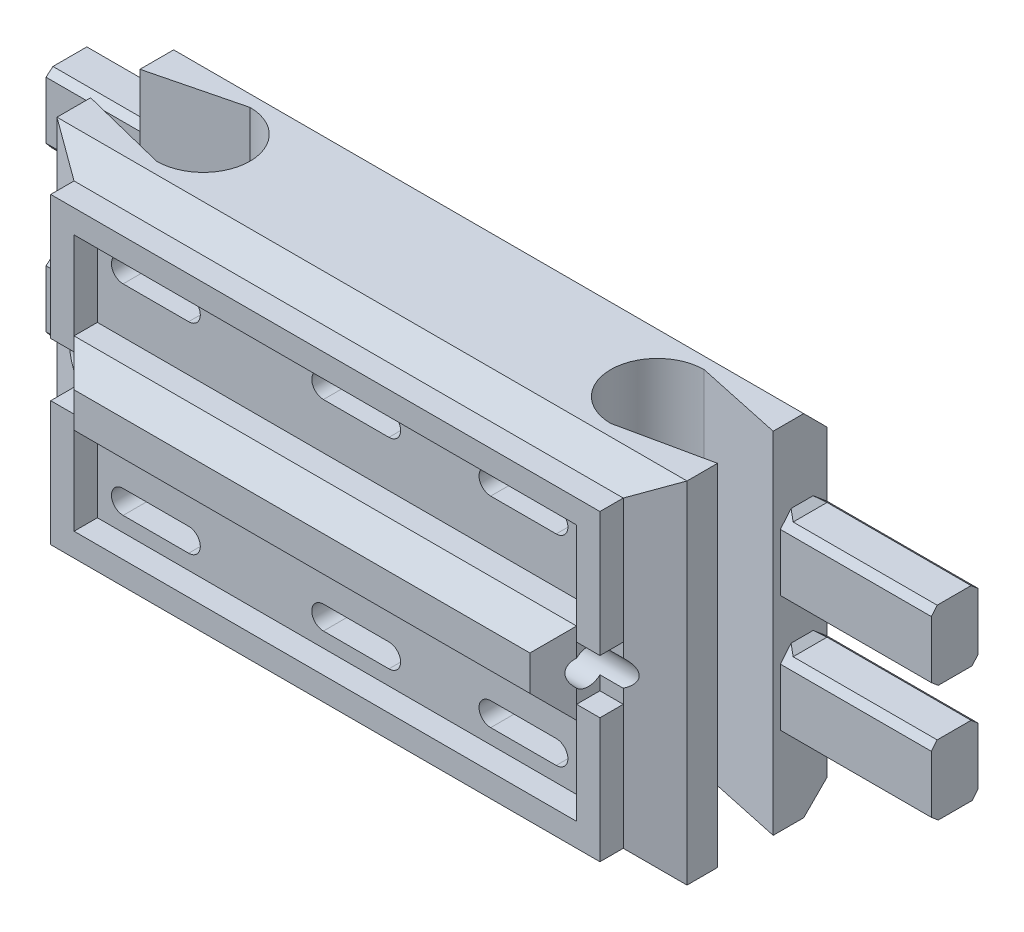
from build123d import *
from OCP.BRepFilletAPI import BRepFilletAPI_MakeChamfer

# Parameters (mm, degrees)
BASE_W                  = 27
BASE_H                  = 15
BOSS_EXTRUDE1_DEPTH     = 7
CHAMFER4_SIZE           = 1
CHAMFER5_SIZE           = 1
CHAMFER5_SIZE2          = 1.732050808
CHAMFER6_SIZE           = 1
SKETCH8_W               = 21.535898384
SKETCH8_H               = 3.5
BOSS_EXTRUDE5_DEPTH     = 2
CUT_EXTRUDE5_DEPTH      = 4.254422658
CUT_EXTRUDE5_DEPTH_BACK = 34.5
SKETCH9_R               = 0.75
CHAMFER9_SIZE           = 1
SKETCH13_W              = 7.5
SKETCH13_H              = 3.5
BOSS_EXTRUDE6_DEPTH     = 2
CHAMFER10_SIZE          = 1
CUT_EXTRUDE6_DEPTH      = 3
CUT_EXTRUDE6_DEPTH_BACK = 30
SKETCH14_R              = 0.75
SKETCH15_W              = 1
SKETCH15_H              = 3.5
BOSS_EXTRUDE7_DEPTH     = 2
CUT_EXTRUDE7_DEPTH      = 26
CHAMFER11_SIZE          = 0.3
CHAMFER12_SIZE          = 0.75
CUT_EXTRUDE8_DEPTH      = 15
SKETCH18_W              = 2
SKETCH18_H              = 3
BOSS_EXTRUDE8_DEPTH     = 6.47
CHAMFER13_SIZE          = 0.25
CHAMFER13_SIZE2         = 0.297938398
CHAMFER14_SIZE          = 0.25
CHAMFER14_SIZE2         = 0.297938398
SKETCH19_W              = 2
SKETCH19_H              = 3
BOSS_EXTRUDE9_DEPTH     = 4.47
CHAMFER15_SIZE          = 0.25
CHAMFER15_SIZE2         = 0.297938398
CHAMFER16_SIZE          = 0.25
CHAMFER16_SIZE2         = 0.297938398
BOSS_EXTRUDE10_DEPTH    = 1
CUT_EXTRUDE9_DEPTH      = 1


with BuildPart() as part:
    # Base → Boss-Extrude1 (new body)
    with BuildSketch(Plane.XY):
        with Locations((13.5, 7.5)):
            Rectangle(BASE_W, BASE_H)
    extrude(amount=BOSS_EXTRUDE1_DEPTH)

    # Chamfer4
    chamfer4_edges = [part.edges().sort_by_distance(p)[0] for p in [
        (13.5, 15, 7),
        (13.5, 0, 7),
    ]]
    chamfer(chamfer4_edges, length=CHAMFER4_SIZE)

    # Chamfer5: one chamfer whose edges measure the first distance from different faces: ONE call of the kernel's chamfer builder (chamfer() names one face for all edges)
    chamfer5_edges_1 = [part.edges().sort_by_distance(p)[0] for p in [
        (0, 7.5, 7),
    ]]
    chamfer5_side_1 = [part.faces().sort_by_distance(p)[0] for p in [
        (0, 7.5, 3.469551282),
    ]]
    chamfer5_edges_2 = [part.edges().sort_by_distance(p)[0] for p in [
        (27, 7.5, 7),
    ]]
    chamfer5_side_2 = [part.faces().sort_by_distance(p)[0] for p in [
        (27, 7.5, 3.469551282),
    ]]
    chamfer5 = BRepFilletAPI_MakeChamfer(part.part.solid().wrapped)
    for e in chamfer5_edges_1:
        chamfer5.Add(CHAMFER5_SIZE, CHAMFER5_SIZE2, e.wrapped, chamfer5_side_1[0].wrapped)  # the first distance lies on this face
    for e in chamfer5_edges_2:
        chamfer5.Add(CHAMFER5_SIZE, CHAMFER5_SIZE2, e.wrapped, chamfer5_side_2[0].wrapped)  # the first distance lies on this face
    add(Compound.cast(chamfer5.Shape()), mode=Mode.REPLACE)

    # Chamfer6
    chamfer6_edges = [part.edges().sort_by_distance(p)[0] for p in [
        (13.5, 15, 0),
        (13.5, 0, 0),
    ]]
    chamfer(chamfer6_edges, length=CHAMFER6_SIZE)

    # Sketch8 → Boss-Extrude5 (add)
    with BuildSketch(Plane.XY.offset(7)):
        with Locations((13.5, 7.5)):
            Rectangle(SKETCH8_W, SKETCH8_H)
    extrude(amount=BOSS_EXTRUDE5_DEPTH)

    # Sketch9 → Cut-Extrude5 (cut, two sides: drawn at the far end of the back side and taken through both)
    with BuildSketch(Plane(origin=(24.267949192, 0, 0), x_dir=(0, 0, -1), z_dir=(1, 0, 0)).offset(-CUT_EXTRUDE5_DEPTH_BACK)):
        with Locations(Location((-7.5, 7.5, 0), (0, 0, 311.810314896))):
            Circle(SKETCH9_R)
    extrude(amount=CUT_EXTRUDE5_DEPTH + CUT_EXTRUDE5_DEPTH_BACK, mode=Mode.SUBTRACT)

    # Chamfer9
    # the kernel refuses this chamfer: 1 mm, written as the material it takes off along each edge
    with BuildSketch(Plane(origin=(26.83963218, 5.75, 9), x_dir=(0, -0.027495876610586487, -0.9996219169112968), z_dir=(-1, 0, 0)), Plane(origin=(0.16036782, 9.25, 9), x_dir=(0, 0.027495876610585623, -0.9996219169112968), z_dir=(1, 0, 0))) as chamfer9_piece_1:
        Polygon((CHAMFER9_SIZE * 0.999621916911, -CHAMFER9_SIZE * 0.0274958766106), (-CHAMFER9_SIZE * 0.0274958766106, -CHAMFER9_SIZE * 0.999621916911), (0, 0), align=None)
    extrude(amount=26.679264361, mode=Mode.SUBTRACT)
    with BuildSketch(Plane(origin=(24.267949192, 11.821682988, 9), x_dir=(0.027495876610585623, 0, -0.9996219169112968), z_dir=(0, -1, 0)), Plane(origin=(2.732050808, 3.178317012, 9), x_dir=(-0.027495876610586487, 0, -0.9996219169112968), z_dir=(0, 1, 0))) as chamfer9_piece_2:
        Polygon((CHAMFER9_SIZE * 0.999621916911, -CHAMFER9_SIZE * 0.0274958766106), (-CHAMFER9_SIZE * 0.0274958766106, -CHAMFER9_SIZE * 0.999621916911), (0, 0), align=None)
    extrude(amount=8.643365976, mode=Mode.SUBTRACT)

    # Sketch13 → Boss-Extrude6 (add)
    with BuildSketch(Plane(origin=(0, 0, 0), x_dir=(-1, 0, 0), z_dir=(0, 0, -1))):
        with Locations((-4.75, 7.5)):
            Rectangle(SKETCH13_W, SKETCH13_H)
        with Locations((-22.25, 7.5)):
            Rectangle(SKETCH13_W, SKETCH13_H)
    extrude(amount=BOSS_EXTRUDE6_DEPTH)

    # Chamfer10
    chamfer10_edges = [part.edges().sort_by_distance(p)[0] for p in [
        (22.25, 9.25, -2),
        (26, 7.5, -2),
        (22.25, 5.75, -2),
        (18.5, 7.5, -2),
        (8.5, 7.5, -2),
        (4.75, 5.75, -2),
        (1, 7.5, -2),
        (4.75, 9.25, -2),
    ]]
    chamfer(chamfer10_edges, length=CHAMFER10_SIZE)

    # Sketch14 → Cut-Extrude6 (cut, two sides: drawn at the far end of the back side and taken through both)
    with BuildSketch(Plane.ZY.offset(-1).offset(-CUT_EXTRUDE6_DEPTH_BACK)):
        with Locations(Location((-0.5, 7.5, 0), (0, 0, 131.810314896))):
            Circle(SKETCH14_R)
    extrude(amount=CUT_EXTRUDE6_DEPTH + CUT_EXTRUDE6_DEPTH_BACK, mode=Mode.SUBTRACT)

    # Sketch15 → Boss-Extrude7 (add)
    with BuildSketch(Plane(origin=(0, 0, 0), x_dir=(-1, 0, 0), z_dir=(0, 0, -1))):
        with Locations((-24.5, 5)):
            Rectangle(SKETCH15_W, SKETCH15_H)
        with Locations((-24.5, 10)):
            Rectangle(SKETCH15_W, SKETCH15_H)
        with Locations((-2.5, 5)):
            Rectangle(SKETCH15_W, SKETCH15_H)
        with Locations((-2.5, 10)):
            Rectangle(SKETCH15_W, SKETCH15_H)
    extrude(amount=BOSS_EXTRUDE7_DEPTH)

    # Sketch16 → Cut-Extrude7 (cut)
    with BuildSketch(Plane(origin=(25, 0, 0), x_dir=(0, 0, -1), z_dir=(1, 0, 0))):
        with BuildLine():
            Line((1.2, 5.15), (1.2, 4.35))
            ThreePointArc((1.2, 4.35), (0.6, 3.75), (0, 4.35))
            Line((0, 4.35), (0, 5.15))
            ThreePointArc((0, 5.15), (0.6, 5.75), (1.2, 5.15))
        make_face()
        with BuildLine():
            Line((0, 9.85), (0, 10.65))
            ThreePointArc((0, 10.65), (0.6, 11.25), (1.2, 10.65))
            Line((1.2, 10.65), (1.2, 9.85))
            ThreePointArc((1.2, 9.85), (0.6, 9.25), (0, 9.85))
        make_face()
    extrude(amount=-CUT_EXTRUDE7_DEPTH, mode=Mode.SUBTRACT)

    # Chamfer11
    chamfer11_edges = [part.edges().sort_by_distance(p)[0] for p in [
        (25, 5, -2),
        (24, 5, -2),
        (2, 5, -2),
        (3, 5, -2),
        (25, 10, -2),
        (24, 10, -2),
        (2, 10, -2),
        (3, 10, -2),
    ]]
    chamfer(chamfer11_edges, length=CHAMFER11_SIZE)

    # Chamfer12
    chamfer12_edges = [part.edges().sort_by_distance(p)[0] for p in [
        (24.5, 3.25, -2),
        (24.5, 11.75, -2),
        (2.5, 11.75, -2),
        (2.5, 3.25, -2),
    ]]
    chamfer(chamfer12_edges, length=CHAMFER12_SIZE)

    # Tendon extrude → Cut-Extrude8 (cut)
    with BuildSketch(Plane.XZ):
        with BuildLine():
            Line((0, 4.5575), (0, 2.4425))
            Line((0, 2.4425), (3.77, 1.5))
            ThreePointArc((3.77, 1.5), (5.77, 3.5), (3.77, 5.5))
            Line((3.77, 5.5), (0, 4.5575))
        make_face()
        with BuildLine():
            Line((27, 2.307857143), (27, 4.692142857))
            Line((27, 4.692142857), (23.23, 5.5))
            ThreePointArc((23.23, 5.5), (21.23, 3.5), (23.23, 1.5))
            Line((23.23, 1.5), (27, 2.307857143))
        make_face()
    extrude(amount=-CUT_EXTRUDE8_DEPTH, mode=Mode.SUBTRACT)

    # Sketch18 → Boss-Extrude8 (add)
    with BuildSketch(Plane(origin=(27, 0, 0), x_dir=(0, 0, -1), z_dir=(1, 0, 0))):
        with Locations((-1, 10)):
            Rectangle(SKETCH18_W, SKETCH18_H)
        with Locations((-1, 5)):
            Rectangle(SKETCH18_W, SKETCH18_H)
    extrude(amount=BOSS_EXTRUDE8_DEPTH)

    # Chamfer13: one chamfer whose edges measure the first distance from different faces: ONE call of the kernel's chamfer builder (chamfer() names one face for all edges)
    chamfer13_edges_1 = [part.edges().sort_by_distance(p)[0] for p in [
        (30.235, 11.5, 2),
    ]]
    chamfer13_side_1 = [part.faces().sort_by_distance(p)[0] for p in [
        (30.235, 11.5, 1),
    ]]
    chamfer13_edges_2 = [part.edges().sort_by_distance(p)[0] for p in [
        (30.235, 8.5, 2),
    ]]
    chamfer13_side_2 = [part.faces().sort_by_distance(p)[0] for p in [
        (30.235, 10, 2),
    ]]
    chamfer13_edges_3 = [part.edges().sort_by_distance(p)[0] for p in [
        (30.235, 8.5, 0),
    ]]
    chamfer13_side_3 = [part.faces().sort_by_distance(p)[0] for p in [
        (30.235, 8.5, 1),
    ]]
    chamfer13_edges_4 = [part.edges().sort_by_distance(p)[0] for p in [
        (30.235, 11.5, 0),
    ]]
    chamfer13_side_4 = [part.faces().sort_by_distance(p)[0] for p in [
        (15.548708107, 11.179909433, 0),
    ]]
    chamfer13_edges_5 = [part.edges().sort_by_distance(p)[0] for p in [
        (30.235, 6.5, 2),
    ]]
    chamfer13_side_5 = [part.faces().sort_by_distance(p)[0] for p in [
        (30.235, 6.5, 1),
    ]]
    chamfer13_edges_6 = [part.edges().sort_by_distance(p)[0] for p in [
        (30.235, 3.5, 2),
    ]]
    chamfer13_side_6 = [part.faces().sort_by_distance(p)[0] for p in [
        (30.235, 5, 2),
    ]]
    chamfer13_edges_7 = [part.edges().sort_by_distance(p)[0] for p in [
        (30.235, 3.5, 0),
    ]]
    chamfer13_side_7 = [part.faces().sort_by_distance(p)[0] for p in [
        (30.235, 3.5, 1),
    ]]
    chamfer13_edges_8 = [part.edges().sort_by_distance(p)[0] for p in [
        (30.235, 6.5, 0),
    ]]
    chamfer13_side_8 = [part.faces().sort_by_distance(p)[0] for p in [
        (15.548708107, 3.820090567, 0),
    ]]
    chamfer13 = BRepFilletAPI_MakeChamfer(part.part.solid().wrapped)
    for e in chamfer13_edges_1:
        chamfer13.Add(CHAMFER13_SIZE, CHAMFER13_SIZE2, e.wrapped, chamfer13_side_1[0].wrapped)  # the first distance lies on this face
    for e in chamfer13_edges_2:
        chamfer13.Add(CHAMFER13_SIZE, CHAMFER13_SIZE2, e.wrapped, chamfer13_side_2[0].wrapped)  # the first distance lies on this face
    for e in chamfer13_edges_3:
        chamfer13.Add(CHAMFER13_SIZE, CHAMFER13_SIZE2, e.wrapped, chamfer13_side_3[0].wrapped)  # the first distance lies on this face
    for e in chamfer13_edges_4:
        chamfer13.Add(CHAMFER13_SIZE, CHAMFER13_SIZE2, e.wrapped, chamfer13_side_4[0].wrapped)  # the first distance lies on this face
    for e in chamfer13_edges_5:
        chamfer13.Add(CHAMFER13_SIZE, CHAMFER13_SIZE2, e.wrapped, chamfer13_side_5[0].wrapped)  # the first distance lies on this face
    for e in chamfer13_edges_6:
        chamfer13.Add(CHAMFER13_SIZE, CHAMFER13_SIZE2, e.wrapped, chamfer13_side_6[0].wrapped)  # the first distance lies on this face
    for e in chamfer13_edges_7:
        chamfer13.Add(CHAMFER13_SIZE, CHAMFER13_SIZE2, e.wrapped, chamfer13_side_7[0].wrapped)  # the first distance lies on this face
    for e in chamfer13_edges_8:
        chamfer13.Add(CHAMFER13_SIZE, CHAMFER13_SIZE2, e.wrapped, chamfer13_side_8[0].wrapped)  # the first distance lies on this face
    add(Compound.cast(chamfer13.Shape()), mode=Mode.REPLACE)

    # Chamfer14
    chamfer14_edges = [part.edges().sort_by_distance(p)[0] for p in [
        (27, 3.5, 0.976030801),
        (27, 6.5, 1.023969199),
        (27, 8.5, 0.976030801),
        (27, 11.5, 1.023969199),
    ]]
    chamfer14_side = [part.faces().sort_by_distance(p)[0] for p in [
        (27, 7.5, 1.284007615),
    ]]
    chamfer(chamfer14_edges, length=CHAMFER14_SIZE, length2=CHAMFER14_SIZE2, reference=chamfer14_side[0])

    # Sketch19 → Boss-Extrude9 (add)
    with BuildSketch(Plane.ZY):
        with Locations((1, 4)):
            Rectangle(SKETCH19_W, SKETCH19_H)
        with Locations((1, 11)):
            Rectangle(SKETCH19_W, SKETCH19_H)
    extrude(amount=BOSS_EXTRUDE9_DEPTH)

    # Chamfer15: one chamfer whose edges measure the first distance from different faces: ONE call of the kernel's chamfer builder (chamfer() names one face for all edges)
    chamfer15_edges_1 = [part.edges().sort_by_distance(p)[0] for p in [
        (-2.235, 5.5, 0),
    ]]
    chamfer15_side_1 = [part.faces().sort_by_distance(p)[0] for p in [
        (-2.235, 5.5, 1),
    ]]
    chamfer15_edges_2 = [part.edges().sort_by_distance(p)[0] for p in [
        (-2.235, 2.5, 0),
    ]]
    chamfer15_side_2 = [part.faces().sort_by_distance(p)[0] for p in [
        (13.823553095, 3.811836534, 0),
    ]]
    chamfer15_edges_3 = [part.edges().sort_by_distance(p)[0] for p in [
        (-2.235, 2.5, 2),
    ]]
    chamfer15_side_3 = [part.faces().sort_by_distance(p)[0] for p in [
        (-2.235, 2.5, 1),
    ]]
    chamfer15_edges_4 = [part.edges().sort_by_distance(p)[0] for p in [
        (-2.235, 5.5, 2),
    ]]
    chamfer15_side_4 = [part.faces().sort_by_distance(p)[0] for p in [
        (-2.235, 4, 2),
    ]]
    chamfer15_edges_5 = [part.edges().sort_by_distance(p)[0] for p in [
        (-2.235, 9.5, 0),
    ]]
    chamfer15_side_5 = [part.faces().sort_by_distance(p)[0] for p in [
        (13.823553095, 11.192679261, 0),
    ]]
    chamfer15_edges_6 = [part.edges().sort_by_distance(p)[0] for p in [
        (-2.235, 9.5, 2),
    ]]
    chamfer15_side_6 = [part.faces().sort_by_distance(p)[0] for p in [
        (-2.235, 9.5, 1),
    ]]
    chamfer15_edges_7 = [part.edges().sort_by_distance(p)[0] for p in [
        (-2.235, 12.5, 2),
    ]]
    chamfer15_side_7 = [part.faces().sort_by_distance(p)[0] for p in [
        (-2.235, 11, 2),
    ]]
    chamfer15_edges_8 = [part.edges().sort_by_distance(p)[0] for p in [
        (-2.235, 12.5, 0),
    ]]
    chamfer15_side_8 = [part.faces().sort_by_distance(p)[0] for p in [
        (-2.235, 12.5, 1),
    ]]
    chamfer15 = BRepFilletAPI_MakeChamfer(part.part.solid().wrapped)
    for e in chamfer15_edges_1:
        chamfer15.Add(CHAMFER15_SIZE, CHAMFER15_SIZE2, e.wrapped, chamfer15_side_1[0].wrapped)  # the first distance lies on this face
    for e in chamfer15_edges_2:
        chamfer15.Add(CHAMFER15_SIZE, CHAMFER15_SIZE2, e.wrapped, chamfer15_side_2[0].wrapped)  # the first distance lies on this face
    for e in chamfer15_edges_3:
        chamfer15.Add(CHAMFER15_SIZE, CHAMFER15_SIZE2, e.wrapped, chamfer15_side_3[0].wrapped)  # the first distance lies on this face
    for e in chamfer15_edges_4:
        chamfer15.Add(CHAMFER15_SIZE, CHAMFER15_SIZE2, e.wrapped, chamfer15_side_4[0].wrapped)  # the first distance lies on this face
    for e in chamfer15_edges_5:
        chamfer15.Add(CHAMFER15_SIZE, CHAMFER15_SIZE2, e.wrapped, chamfer15_side_5[0].wrapped)  # the first distance lies on this face
    for e in chamfer15_edges_6:
        chamfer15.Add(CHAMFER15_SIZE, CHAMFER15_SIZE2, e.wrapped, chamfer15_side_6[0].wrapped)  # the first distance lies on this face
    for e in chamfer15_edges_7:
        chamfer15.Add(CHAMFER15_SIZE, CHAMFER15_SIZE2, e.wrapped, chamfer15_side_7[0].wrapped)  # the first distance lies on this face
    for e in chamfer15_edges_8:
        chamfer15.Add(CHAMFER15_SIZE, CHAMFER15_SIZE2, e.wrapped, chamfer15_side_8[0].wrapped)  # the first distance lies on this face
    add(Compound.cast(chamfer15.Shape()), mode=Mode.REPLACE)

    # Chamfer16
    chamfer16_edges = [part.edges().sort_by_distance(p)[0] for p in [
        (0, 2.5, 1.023969199),
        (0, 5.5, 0.976030801),
        (0, 12.5, 0.976030801),
        (0, 9.5, 1.023969199),
    ]]
    chamfer16_side = [part.faces().sort_by_distance(p)[0] for p in [
        (0, 7.5, 1.376830037),
    ]]
    chamfer(chamfer16_edges, length=CHAMFER16_SIZE, length2=CHAMFER16_SIZE2, reference=chamfer16_side[0])

    # Sketch21 → Boss-Extrude10 (add)
    with BuildSketch(Plane.XY.offset(7)):
        Polygon((2.732050808, 6.345491503), (1.732050808, 6.345491503), (1.732050808, 1), (25.267949192, 1), (25.267949192, 6.345491503), (24.267949192, 6.345491503), (24.267949192, 2), (2.732050808, 2), align=None)
        Polygon((2.732050808, 8.654508497), (1.732050808, 8.654508497), (1.732050808, 14), (25.267949192, 14), (25.267949192, 8.654508497), (24.267949192, 8.654508497), (24.267949192, 13), (2.732050808, 13), align=None)
    extrude(amount=BOSS_EXTRUDE10_DEPTH)

    # Sketch28 → Cut-Extrude9 (cut)
    with BuildSketch(Plane.XY.offset(7)):
        with BuildLine():
            Line((3.834860782, 3.639514925), (6.642277586, 3.639514925))
            ThreePointArc((6.642277586, 3.639514925), (7.142277586, 3.139514925), (6.642277586, 2.639514925))
            Line((6.642277586, 2.639514925), (3.834860782, 2.639514925))
            ThreePointArc((3.834860782, 2.639514925), (3.334860782, 3.139514925), (3.834860782, 3.639514925))
        make_face()
        with BuildLine():
            Line((12.41898194, 3.639514925), (15.226398744, 3.639514925))
            ThreePointArc((15.226398744, 3.639514925), (15.726398744, 3.139514925), (15.226398744, 2.639514925))
            Line((15.226398744, 2.639514925), (12.41898194, 2.639514925))
            ThreePointArc((12.41898194, 2.639514925), (11.91898194, 3.139514925), (12.41898194, 3.639514925))
        make_face()
        with BuildLine():
            Line((19.587328842, 3.639514925), (22.394745646, 3.639514925))
            ThreePointArc((22.394745646, 3.639514925), (22.894745646, 3.139514925), (22.394745646, 2.639514925))
            Line((22.394745646, 2.639514925), (19.587328842, 2.639514925))
            ThreePointArc((19.587328842, 2.639514925), (19.087328842, 3.139514925), (19.587328842, 3.639514925))
        make_face()
        with BuildLine():
            Line((19.587328842, 12.232128331), (22.394745646, 12.232128331))
            ThreePointArc((22.394745646, 12.232128331), (22.894745646, 11.732128331), (22.394745646, 11.232128331))
            Line((22.394745646, 11.232128331), (19.587328842, 11.232128331))
            ThreePointArc((19.587328842, 11.232128331), (19.087328842, 11.732128331), (19.587328842, 12.232128331))
        make_face()
        with BuildLine():
            Line((12.41898194, 12.232128331), (15.226398744, 12.232128331))
            ThreePointArc((15.226398744, 12.232128331), (15.726398744, 11.732128331), (15.226398744, 11.232128331))
            Line((15.226398744, 11.232128331), (12.41898194, 11.232128331))
            ThreePointArc((12.41898194, 11.232128331), (11.91898194, 11.732128331), (12.41898194, 12.232128331))
        make_face()
        with BuildLine():
            Line((3.834860782, 12.232128331), (6.642277586, 12.232128331))
            ThreePointArc((6.642277586, 12.232128331), (7.142277586, 11.732128331), (6.642277586, 11.232128331))
            Line((6.642277586, 11.232128331), (3.834860782, 11.232128331))
            ThreePointArc((3.834860782, 11.232128331), (3.334860782, 11.732128331), (3.834860782, 12.232128331))
        make_face()
    extrude(amount=-CUT_EXTRUDE9_DEPTH, mode=Mode.SUBTRACT)


solid = part.part
